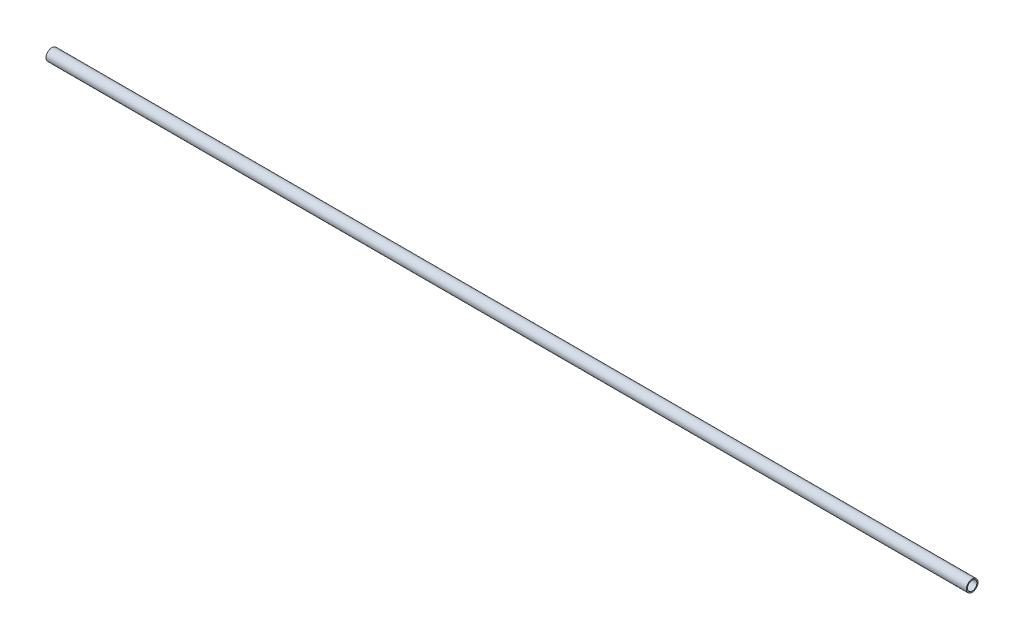
from build123d import *

# Parameters (mm, degrees)
SKETCH1_R           = 0.254
SKETCH1_R_2         = 0.2032
BOSS_EXTRUDE1_DEPTH = 40


with BuildPart() as part:
    # Sketch1 → Boss-Extrude1 (new body)
    with BuildSketch(Plane(origin=(0, 0, 0), x_dir=(0, 0, -1), z_dir=(1, 0, 0))):
        Circle(SKETCH1_R)
        Circle(SKETCH1_R_2, mode=Mode.SUBTRACT)
    extrude(amount=BOSS_EXTRUDE1_DEPTH)


solid = part.part
